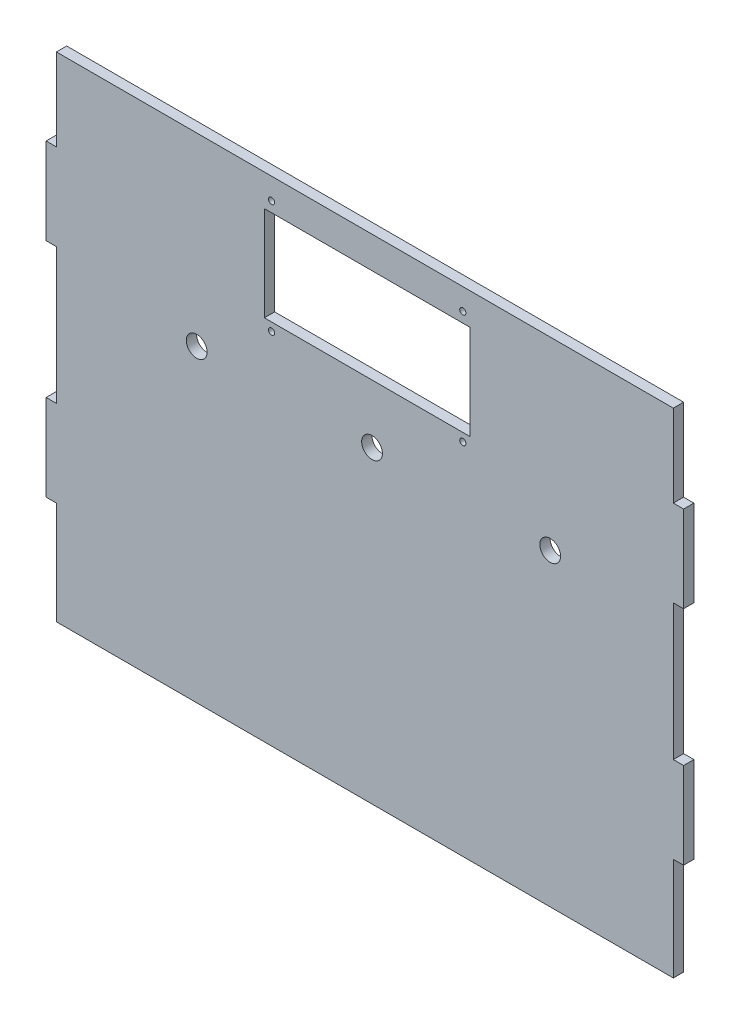
from build123d import *

# Parameters (mm, degrees)
ESQUISSE1_W                          = 300
ESQUISSE1_H                          = 240
BOSS_EXTRU_1_DEPTH                   = 5
TENON_START                          = -190
TENON_ET_MORTAISE_TENON1_OUTLINE_W   = 5
TENON_ET_MORTAISE_TENON1_OUTLINE_H   = 5
TENON_ET_MORTAISE_TENON1_DEPTH       = 42
TENON_START_2                        = -82
TENON_ET_MORTAISE_TENON1_2_OUTLINE_W = 5
TENON_ET_MORTAISE_TENON1_2_OUTLINE_H = 5
TENON_ET_MORTAISE_TENON1_2_DEPTH     = 42
TENON_ET_MORTAISE_TENON2_OUTLINE_W   = 5
TENON_ET_MORTAISE_TENON2_OUTLINE_H   = 5
TENON_ET_MORTAISE_TENON2_DEPTH       = 42
TENON_ET_MORTAISE_TENON2_2_OUTLINE_W = 5
TENON_ET_MORTAISE_TENON2_2_OUTLINE_H = 5
TENON_ET_MORTAISE_TENON2_2_DEPTH     = 42
ESQUISSE2_R                          = 5.05
ENL_V_MAT_EXTRU_1_DEPTH              = 10
ESQUISSE3_W                          = 100
ESQUISSE3_H                          = 46
ENL_V_MAT_EXTRU_3_DEPTH              = 10
ESQUISSE5_R                          = 1.5
ENL_V_MAT_EXTRU_4_DEPTH              = 10


# Read off the part's stored shape, not the designer's step: Tenon et mortaise-Tenon1, Tenon et mortaise-Tenon2
with BuildPart() as part:
    # Esquisse1 → Boss.-Extru.1 (new body)
    with BuildSketch(Plane.XY):
        with Locations((-150, -120)):
            Rectangle(ESQUISSE1_W, ESQUISSE1_H)
    extrude(amount=BOSS_EXTRU_1_DEPTH)

    # Tenon et mortaise-Tenon1 outline → Tenon et mortaise-Tenon1 (add)
    with BuildSketch(Plane(origin=(0, 0, 0), x_dir=(1, 0, 0), z_dir=(0, 1, 0)).offset(TENON_START)):
        with Locations((-302.5, -2.5)):
            Rectangle(TENON_ET_MORTAISE_TENON1_OUTLINE_W, TENON_ET_MORTAISE_TENON1_OUTLINE_H)
    extrude(amount=TENON_ET_MORTAISE_TENON1_DEPTH)

    # Tenon et mortaise-Tenon1 2 outline → Tenon et mortaise-Tenon1 2 (add)
    with BuildSketch(Plane(origin=(0, 0, 0), x_dir=(1, 0, 0), z_dir=(0, 1, 0)).offset(TENON_START_2)):
        with Locations((-302.5, -2.5)):
            Rectangle(TENON_ET_MORTAISE_TENON1_2_OUTLINE_W, TENON_ET_MORTAISE_TENON1_2_OUTLINE_H)
    extrude(amount=TENON_ET_MORTAISE_TENON1_2_DEPTH)

    # Tenon et mortaise-Tenon2 outline → Tenon et mortaise-Tenon2 (add)
    with BuildSketch(Plane(origin=(0, 0, 0), x_dir=(1, 0, 0), z_dir=(0, 1, 0)).offset(TENON_START)):
        with Locations((2.5, -2.5)):
            Rectangle(TENON_ET_MORTAISE_TENON2_OUTLINE_W, TENON_ET_MORTAISE_TENON2_OUTLINE_H)
    extrude(amount=TENON_ET_MORTAISE_TENON2_DEPTH)

    # Tenon et mortaise-Tenon2 2 outline → Tenon et mortaise-Tenon2 2 (add)
    with BuildSketch(Plane(origin=(0, 0, 0), x_dir=(1, 0, 0), z_dir=(0, 1, 0)).offset(TENON_START_2)):
        with Locations((2.5, -2.5)):
            Rectangle(TENON_ET_MORTAISE_TENON2_2_OUTLINE_W, TENON_ET_MORTAISE_TENON2_2_OUTLINE_H)
    extrude(amount=TENON_ET_MORTAISE_TENON2_2_DEPTH)

    # Esquisse2 → Enlèv. mat.-Extru.1 (cut)
    with BuildSketch(Plane.XY.offset(5)):
        with Locations((-231.788943558, -89.854265633)):
            Circle(ESQUISSE2_R)
        with Locations((-146.505843122, -89.854265633)):
            Circle(ESQUISSE2_R)
        with Locations((-59.877583373, -89.854265633)):
            Circle(ESQUISSE2_R)
    extrude(amount=-ENL_V_MAT_EXTRU_1_DEPTH, mode=Mode.SUBTRACT)

    # Esquisse3 → Enlèv. mat.-Extru.3 (cut)
    with BuildSketch(Plane.XY.offset(5)):
        with Locations((-148.865660617, -38.407404502)):
            Rectangle(ESQUISSE3_W, ESQUISSE3_H)
    extrude(amount=-ENL_V_MAT_EXTRU_3_DEPTH, mode=Mode.SUBTRACT)

    # Esquisse5 → Enlèv. mat.-Extru.4 (cut)
    with BuildSketch(Plane.XY.offset(5)):
        with Locations((-102.365660617, -10.407404502)):
            Circle(ESQUISSE5_R)
        with Locations((-195.365660617, -10.407404502)):
            Circle(ESQUISSE5_R)
        with Locations((-195.365660617, -65.407404502)):
            Circle(ESQUISSE5_R)
        with Locations((-102.365660617, -65.407404502)):
            Circle(ESQUISSE5_R)
    extrude(amount=-ENL_V_MAT_EXTRU_4_DEPTH, mode=Mode.SUBTRACT)


solid = part.part
